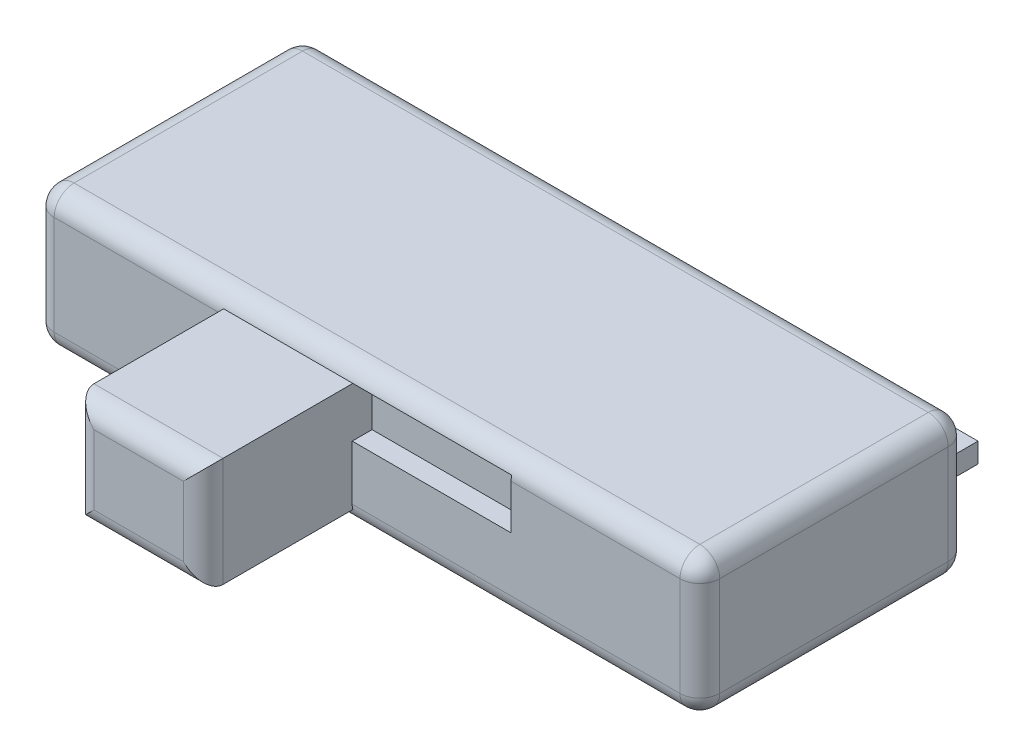
from build123d import *

# Parameters (mm, degrees)
SKETCH_1_W          = 6.7
SKETCH_1_H          = 2.7
EXTRUDE_1_DEPTH     = 1.4
SKETCH_2_W          = 2.9
SKETCH_2_H          = 0.5
CUT_EXTRUDE_1_DEPTH = 0.2
SKETCH_3_W          = 1.3
SKETCH_3_H          = 1.1
EXTRUDE_2_DEPTH     = 1.7
SKETCH_4_W          = 0.4
SKETCH_4_H          = 1
EXTRUDE_3_DEPTH     = 0.2
SKETCH_6_R          = 0.35
EXTRUDE_4_DEPTH     = 0.5
FILLET_1_R          = 0.2
CHAMFER_1_SIZE      = 0.2


with BuildPart() as part:
    # Эскиз1 → Бобышка-Вытянуть1 (new body)
    with BuildSketch(Plane(origin=(0, 0, 0), x_dir=(1, 0, 0), z_dir=(0, 1, 0))):
        Rectangle(SKETCH_1_W, SKETCH_1_H)
    extrude(amount=EXTRUDE_1_DEPTH)

    # Эскиз2 → Вырез-Вытянуть1 (cut)
    with BuildSketch(Plane.XY.offset(1.35)):
        with Locations((0, 1)):
            Rectangle(SKETCH_2_W, SKETCH_2_H)
    extrude(amount=-CUT_EXTRUDE_1_DEPTH, mode=Mode.SUBTRACT)

    # Эскиз3 → Бобышка-Вытянуть2 (add)
    with BuildSketch(Plane.XY.offset(1.15)):
        with Locations((-0.8, 0.7)):
            Rectangle(SKETCH_3_W, SKETCH_3_H)
    extrude(amount=EXTRUDE_2_DEPTH)

    # Эскиз4 → Бобышка-Вытянуть3 (add)
    with BuildSketch(Plane.XZ):
        with Locations((-2.25, -1.85)):
            Rectangle(SKETCH_4_W, SKETCH_4_H)
        with Locations((0.75, -1.85)):
            Rectangle(SKETCH_4_W, SKETCH_4_H)
        with Locations((2.25, -1.85)):
            Rectangle(SKETCH_4_W, SKETCH_4_H)
    extrude(amount=-EXTRUDE_3_DEPTH)

    # Эскиз6 → Бобышка-Вытянуть4 (add)
    with BuildSketch(Plane.XZ):
        with Locations(Location((-1.5, 0, 0), (0, 0, 270))):
            Circle(SKETCH_6_R)
        with Locations(Location((1.5, 0, 0), (0, 0, 270))):
            Circle(SKETCH_6_R)
    extrude(amount=EXTRUDE_4_DEPTH)

    # Скругление1
    # the kernel refuses this fillet: 0.2 mm, written as the material it takes off along each edge
    with BuildSketch(Plane(origin=(3.15, 0.2, 1.15), x_dir=(1, 0, 0), z_dir=(0, 0, 1))) as fillet_1_piece_1_section:
        Polygon((0, 0), (FILLET_1_R * 1.02, 0), (FILLET_1_R * 1.02, -FILLET_1_R * 1.02), (0, -FILLET_1_R * 1.02), align=None)
    fillet_1_piece_1 = extrude(amount=FILLET_1_R * 1.02, mode=Mode.PRIVATE)
    fillet_1_piece_1 = fillet_1_piece_1 - Plane(origin=(3.15, 0.2, 1.15), x_dir=(-0.7071067811865475, 0.7071067811865475, 0), z_dir=(0, 0, 1)) * Sphere(FILLET_1_R, mode=Mode.PRIVATE)
    add(fillet_1_piece_1, mode=Mode.SUBTRACT)
    with BuildSketch(Plane(origin=(3.15, 1.2, 1.15), x_dir=(0, 1, 0), z_dir=(0, 0, 1))) as fillet_1_piece_2_section:
        Polygon((0, 0), (FILLET_1_R * 1.02, 0), (FILLET_1_R * 1.02, -FILLET_1_R * 1.02), (0, -FILLET_1_R * 1.02), align=None)
    fillet_1_piece_2 = extrude(amount=FILLET_1_R * 1.02, mode=Mode.PRIVATE)
    fillet_1_piece_2 = fillet_1_piece_2 - Plane(origin=(3.15, 1.2, 1.15), x_dir=(-0.7071067811865475, -0.7071067811865475, 0), z_dir=(0, 0, 1)) * Sphere(FILLET_1_R, mode=Mode.PRIVATE)
    add(fillet_1_piece_2, mode=Mode.SUBTRACT)
    with BuildSketch(Plane(origin=(3.15, 1.2, -1.15), x_dir=(1, 0, 0), z_dir=(0, 1, 0))) as fillet_1_piece_3_section:
        Polygon((0, 0), (FILLET_1_R * 1.02, 0), (FILLET_1_R * 1.02, FILLET_1_R * 1.02), (0, FILLET_1_R * 1.02), align=None)
    fillet_1_piece_3 = extrude(amount=FILLET_1_R * 1.02, mode=Mode.PRIVATE)
    fillet_1_piece_3 = fillet_1_piece_3 - Plane(origin=(3.15, 1.2, -1.15), x_dir=(-0.7071067811865475, 0, 0.7071067811865475), z_dir=(0, 1, 0)) * Sphere(FILLET_1_R, mode=Mode.PRIVATE)
    add(fillet_1_piece_3, mode=Mode.SUBTRACT)
    with BuildSketch(Plane(origin=(3.15, 0.2, -1.15), x_dir=(0, 0, -1), z_dir=(1, 0, 0))) as fillet_1_piece_4_section:
        Polygon((0, 0), (FILLET_1_R * 1.02, 0), (FILLET_1_R * 1.02, -FILLET_1_R * 1.02), (0, -FILLET_1_R * 1.02), align=None)
    fillet_1_piece_4 = extrude(amount=FILLET_1_R * 1.02, mode=Mode.PRIVATE)
    fillet_1_piece_4 = fillet_1_piece_4 - Plane(origin=(3.15, 0.2, -1.15), x_dir=(0, 0.7071067811865475, 0.7071067811865475), z_dir=(1, 0, 0)) * Sphere(FILLET_1_R, mode=Mode.PRIVATE)
    add(fillet_1_piece_4, mode=Mode.SUBTRACT)
    with BuildSketch(Plane(origin=(-3.15, 0.2, -1.15), x_dir=(0, 0, -1), z_dir=(-1, 0, 0))) as fillet_1_piece_5_section:
        Polygon((0, 0), (FILLET_1_R * 1.02, 0), (FILLET_1_R * 1.02, FILLET_1_R * 1.02), (0, FILLET_1_R * 1.02), align=None)
    fillet_1_piece_5 = extrude(amount=FILLET_1_R * 1.02, mode=Mode.PRIVATE)
    fillet_1_piece_5 = fillet_1_piece_5 - Plane(origin=(-3.15, 0.2, -1.15), x_dir=(0, 0.7071067811865475, 0.7071067811865475), z_dir=(-1, 0, 0)) * Sphere(FILLET_1_R, mode=Mode.PRIVATE)
    add(fillet_1_piece_5, mode=Mode.SUBTRACT)
    with BuildSketch(Plane(origin=(-3.15, 1.2, -1.15), x_dir=(0, 1, 0), z_dir=(-1, 0, 0))) as fillet_1_piece_6_section:
        Polygon((0, 0), (FILLET_1_R * 1.02, 0), (FILLET_1_R * 1.02, FILLET_1_R * 1.02), (0, FILLET_1_R * 1.02), align=None)
    fillet_1_piece_6 = extrude(amount=FILLET_1_R * 1.02, mode=Mode.PRIVATE)
    fillet_1_piece_6 = fillet_1_piece_6 - Plane(origin=(-3.15, 1.2, -1.15), x_dir=(0, -0.7071067811865475, 0.7071067811865475), z_dir=(-1, 0, 0)) * Sphere(FILLET_1_R, mode=Mode.PRIVATE)
    add(fillet_1_piece_6, mode=Mode.SUBTRACT)
    with BuildSketch(Plane(origin=(-3.15, 1.2, 1.15), x_dir=(-1, 0, 0), z_dir=(0, 0, 1))) as fillet_1_piece_7_section:
        Polygon((0, 0), (FILLET_1_R * 1.02, 0), (FILLET_1_R * 1.02, -FILLET_1_R * 1.02), (0, -FILLET_1_R * 1.02), align=None)
    fillet_1_piece_7 = extrude(amount=FILLET_1_R * 1.02, mode=Mode.PRIVATE)
    fillet_1_piece_7 = fillet_1_piece_7 - Plane(origin=(-3.15, 1.2, 1.15), x_dir=(0.7071067811865475, -0.7071067811865475, 0), z_dir=(0, 0, 1)) * Sphere(FILLET_1_R, mode=Mode.PRIVATE)
    add(fillet_1_piece_7, mode=Mode.SUBTRACT)
    with BuildSketch(Plane(origin=(-3.15, 0.2, 1.15), x_dir=(-1, 0, 0), z_dir=(0, 0, 1))) as fillet_1_piece_8_section:
        Polygon((0, 0), (FILLET_1_R * 1.02, 0), (FILLET_1_R * 1.02, FILLET_1_R * 1.02), (0, FILLET_1_R * 1.02), align=None)
    fillet_1_piece_8 = extrude(amount=FILLET_1_R * 1.02, mode=Mode.PRIVATE)
    fillet_1_piece_8 = fillet_1_piece_8 - Plane(origin=(-3.15, 0.2, 1.15), x_dir=(0.7071067811865475, 0.7071067811865475, 0), z_dir=(0, 0, 1)) * Sphere(FILLET_1_R, mode=Mode.PRIVATE)
    add(fillet_1_piece_8, mode=Mode.SUBTRACT)
    with BuildSketch(Plane(origin=(3.35, 0.2, 1.35), x_dir=(-1, 0, 0), z_dir=(0, 1, 0)), Plane(origin=(3.35, 0.2, -1.35), x_dir=(0, 0, 1), z_dir=(0, 1, 0))) as fillet_1_piece_9:
        with BuildLine():
            CenterArc((FILLET_1_R, -FILLET_1_R), FILLET_1_R, 90, 90)
            Line((0, -FILLET_1_R), (0, 0))
            Line((0, 0), (FILLET_1_R, 0))
        make_face()
    extrude(amount=1, mode=Mode.SUBTRACT)
    with BuildSketch(Plane(origin=(3.35, 1.4, 1.15), x_dir=(-1, 0, 0), z_dir=(0, 0, -1)), Plane(origin=(3.35, 0, 1.15), x_dir=(0, 1, 0), z_dir=(0, 0, -1)), Plane(origin=(-3.35, 0, -1.15), x_dir=(0, 1, 0), z_dir=(0, 0, 1)), Plane(origin=(-1.95, 1.25, 2.85), x_dir=(0, 0, -1), z_dir=(1, 0, 0)), Plane(origin=(0.35, 0.15, 2.85), x_dir=(0, 0, -1), z_dir=(-1, 0, 0))) as fillet_1_piece_10:
        with BuildLine():
            CenterArc((FILLET_1_R, -FILLET_1_R), FILLET_1_R, 90, 90)
            Line((0, -FILLET_1_R), (0, 0))
            Line((0, 0), (FILLET_1_R, 0))
        make_face()
    extrude(amount=2.3, mode=Mode.SUBTRACT)
    with BuildSketch(Plane(origin=(-3.35, 0.2, -1.35), x_dir=(0, 0, 1), z_dir=(0, 1, 0)), Plane(origin=(-3.35, 0.2, 1.35), x_dir=(1, 0, 0), z_dir=(0, 1, 0))) as fillet_1_piece_11:
        with BuildLine():
            CenterArc((FILLET_1_R, FILLET_1_R), FILLET_1_R, 180, 90)
            Line((0, FILLET_1_R), (0, 0))
            Line((0, 0), (FILLET_1_R, 0))
        make_face()
    extrude(amount=1, mode=Mode.SUBTRACT)
    with BuildSketch(Plane(origin=(-3.35, 1.4, -1.15), x_dir=(0, -1, 0), z_dir=(0, 0, 1))) as fillet_1_piece_12:
        with BuildLine():
            CenterArc((FILLET_1_R, FILLET_1_R), FILLET_1_R, 180, 90)
            Line((0, FILLET_1_R), (0, 0))
            Line((0, 0), (FILLET_1_R, 0))
        make_face()
    extrude(amount=2.3, mode=Mode.SUBTRACT)
    with BuildSketch(Plane(origin=(3.15, 0, -1.35), x_dir=(0, 0, 1), z_dir=(-1, 0, 0)), Plane(origin=(-2.45, 0, -1.35), x_dir=(0, 0, 1), z_dir=(-1, 0, 0))) as fillet_1_piece_13:
        with BuildLine():
            CenterArc((FILLET_1_R, FILLET_1_R), FILLET_1_R, 180, 90)
            Line((0, FILLET_1_R), (0, 0))
            Line((0, 0), (FILLET_1_R, 0))
        make_face()
    extrude(amount=0.7, mode=Mode.SUBTRACT)
    with BuildSketch(Plane(origin=(3.15, 0, -1.35), x_dir=(0, 0, 1), z_dir=(-1, 0, 0))) as fillet_1_piece_14_section:
        with BuildLine():
            CenterArc((FILLET_1_R, FILLET_1_R), FILLET_1_R, 180, 90)
            Line((0, FILLET_1_R), (0, 0))
            Line((0, 0), (FILLET_1_R, 0))
        make_face()
    fillet_1_piece_14 = extrude(amount=1.2, mode=Mode.PRIVATE)
    fillet_1_piece_14 = split(fillet_1_piece_14, bisect_by=Plane(origin=(2.05, 0.044673588, -1.305326412), z_dir=(-1, 0, 0)), keep=Keep.TOP, mode=Mode.PRIVATE)
    add(fillet_1_piece_14, mode=Mode.SUBTRACT)
    with BuildSketch(Plane(origin=(2.55, 0, -1.35), x_dir=(0, 0, 1), z_dir=(-1, 0, 0))) as fillet_1_piece_15_section:
        with BuildLine():
            CenterArc((FILLET_1_R, FILLET_1_R), FILLET_1_R, 180, 90)
            Line((0, FILLET_1_R), (0, 0))
            Line((0, 0), (FILLET_1_R, 0))
        make_face()
    fillet_1_piece_15 = extrude(amount=2.1, mode=Mode.PRIVATE)
    fillet_1_piece_15 = split(fillet_1_piece_15, bisect_by=Plane(origin=(2.45, 0.044673588, -1.305326412), z_dir=(1, 0, 0)), keep=Keep.TOP, mode=Mode.PRIVATE)
    add(fillet_1_piece_15, mode=Mode.SUBTRACT)
    with BuildSketch(Plane(origin=(2.05, 0, -1.35), x_dir=(0, 0, 1), z_dir=(-1, 0, 0))) as fillet_1_piece_16:
        with BuildLine():
            CenterArc((FILLET_1_R, FILLET_1_R), FILLET_1_R, 180, 90)
            Line((0, FILLET_1_R), (0, 0))
            Line((0, 0), (FILLET_1_R, 0))
        make_face()
    extrude(amount=1.1, mode=Mode.SUBTRACT)
    with BuildSketch(Plane(origin=(2.55, 0, -1.35), x_dir=(0, 0, 1), z_dir=(-1, 0, 0))) as fillet_1_piece_17_section:
        with BuildLine():
            CenterArc((FILLET_1_R, FILLET_1_R), FILLET_1_R, 180, 90)
            Line((0, FILLET_1_R), (0, 0))
            Line((0, 0), (FILLET_1_R, 0))
        make_face()
    fillet_1_piece_17 = extrude(amount=2.1, mode=Mode.PRIVATE)
    fillet_1_piece_17 = split(fillet_1_piece_17, bisect_by=Plane(origin=(0.55, 0.044673588, -1.305326412), z_dir=(-1, 0, 0)), keep=Keep.TOP, mode=Mode.PRIVATE)
    add(fillet_1_piece_17, mode=Mode.SUBTRACT)
    with BuildSketch(Plane(origin=(1.05, 0, -1.35), x_dir=(0, 0, 1), z_dir=(-1, 0, 0))) as fillet_1_piece_18_section:
        with BuildLine():
            CenterArc((FILLET_1_R, FILLET_1_R), FILLET_1_R, 180, 90)
            Line((0, FILLET_1_R), (0, 0))
            Line((0, 0), (FILLET_1_R, 0))
        make_face()
    fillet_1_piece_18 = extrude(amount=3.6, mode=Mode.PRIVATE)
    fillet_1_piece_18 = split(fillet_1_piece_18, bisect_by=Plane(origin=(0.95, 0.044673588, -1.305326412), z_dir=(1, 0, 0)), keep=Keep.TOP, mode=Mode.PRIVATE)
    add(fillet_1_piece_18, mode=Mode.SUBTRACT)
    with BuildSketch(Plane(origin=(0.55, 0, -1.35), x_dir=(0, 0, 1), z_dir=(-1, 0, 0))) as fillet_1_piece_19:
        with BuildLine():
            CenterArc((FILLET_1_R, FILLET_1_R), FILLET_1_R, 180, 90)
            Line((0, FILLET_1_R), (0, 0))
            Line((0, 0), (FILLET_1_R, 0))
        make_face()
    extrude(amount=2.6, mode=Mode.SUBTRACT)
    with BuildSketch(Plane(origin=(1.05, 0, -1.35), x_dir=(0, 0, 1), z_dir=(-1, 0, 0))) as fillet_1_piece_20_section:
        with BuildLine():
            CenterArc((FILLET_1_R, FILLET_1_R), FILLET_1_R, 180, 90)
            Line((0, FILLET_1_R), (0, 0))
            Line((0, 0), (FILLET_1_R, 0))
        make_face()
    fillet_1_piece_20 = extrude(amount=3.6, mode=Mode.PRIVATE)
    fillet_1_piece_20 = split(fillet_1_piece_20, bisect_by=Plane(origin=(-2.45, 0.044673588, -1.305326412), z_dir=(-1, 0, 0)), keep=Keep.TOP, mode=Mode.PRIVATE)
    add(fillet_1_piece_20, mode=Mode.SUBTRACT)
    with BuildSketch(Plane(origin=(-1.95, 0, -1.35), x_dir=(0, 0, 1), z_dir=(-1, 0, 0))) as fillet_1_piece_21_section:
        with BuildLine():
            CenterArc((FILLET_1_R, FILLET_1_R), FILLET_1_R, 180, 90)
            Line((0, FILLET_1_R), (0, 0))
            Line((0, 0), (FILLET_1_R, 0))
        make_face()
    fillet_1_piece_21 = extrude(amount=1.2, mode=Mode.PRIVATE)
    fillet_1_piece_21 = split(fillet_1_piece_21, bisect_by=Plane(origin=(-2.05, 0.044673588, -1.305326412), z_dir=(1, 0, 0)), keep=Keep.TOP, mode=Mode.PRIVATE)
    add(fillet_1_piece_21, mode=Mode.SUBTRACT)
    with BuildSketch(Plane(origin=(3.15, 1.4, -1.35), x_dir=(0, 0, 1), z_dir=(-1, 0, 0))) as fillet_1_piece_22:
        with BuildLine():
            CenterArc((FILLET_1_R, -FILLET_1_R), FILLET_1_R, 90, 90)
            Line((0, -FILLET_1_R), (0, 0))
            Line((0, 0), (FILLET_1_R, 0))
        make_face()
    extrude(amount=6.3, mode=Mode.SUBTRACT)
    with BuildSketch(Plane(origin=(-3.15, 1.4, 1.35), x_dir=(0, -1, 0), z_dir=(1, 0, 0))) as fillet_1_piece_23_section:
        with BuildLine():
            CenterArc((FILLET_1_R, FILLET_1_R), FILLET_1_R, 180, 90)
            Line((0, FILLET_1_R), (0, 0))
            Line((0, 0), (FILLET_1_R, 0))
        make_face()
    fillet_1_piece_23 = extrude(amount=6.3, mode=Mode.PRIVATE)
    fillet_1_piece_23 = split(fillet_1_piece_23, bisect_by=Plane(origin=(-1.45, 1.237540036, 1.34810005), z_dir=(-1, 0, 0)), keep=Keep.TOP, mode=Mode.PRIVATE)
    add(fillet_1_piece_23, mode=Mode.SUBTRACT)
    with BuildSketch(Plane(origin=(-3.15, 1.4, 1.35), x_dir=(0, -1, 0), z_dir=(1, 0, 0))) as fillet_1_piece_24_section:
        with BuildLine():
            CenterArc((FILLET_1_R, FILLET_1_R), FILLET_1_R, 180, 90)
            Line((0, FILLET_1_R), (0, 0))
            Line((0, 0), (FILLET_1_R, 0))
        make_face()
    fillet_1_piece_24 = extrude(amount=6.3, mode=Mode.PRIVATE)
    fillet_1_piece_24 = split(fillet_1_piece_24, bisect_by=Plane(origin=(-0.8, 1.25, 1.304795882), z_dir=(0, 1, 0)), keep=Keep.TOP, mode=Mode.PRIVATE)
    add(fillet_1_piece_24, mode=Mode.SUBTRACT)
    with BuildSketch(Plane(origin=(-3.15, 1.4, 1.35), x_dir=(0, -1, 0), z_dir=(1, 0, 0))) as fillet_1_piece_25_section:
        with BuildLine():
            CenterArc((FILLET_1_R, FILLET_1_R), FILLET_1_R, 180, 90)
            Line((0, FILLET_1_R), (0, 0))
            Line((0, 0), (FILLET_1_R, 0))
        make_face()
    fillet_1_piece_25 = extrude(amount=6.3, mode=Mode.PRIVATE)
    fillet_1_piece_25 = split(fillet_1_piece_25, bisect_by=Plane(origin=(-0.15, 1.237540036, 1.34810005), z_dir=(1, 0, 0)), keep=Keep.TOP, mode=Mode.PRIVATE)
    add(fillet_1_piece_25, mode=Mode.SUBTRACT)
    with BuildSketch(Plane(origin=(-3.15, 0, 1.35), x_dir=(0, 1, 0), z_dir=(1, 0, 0))) as fillet_1_piece_26_section:
        with BuildLine():
            CenterArc((FILLET_1_R, -FILLET_1_R), FILLET_1_R, 90, 90)
            Line((0, -FILLET_1_R), (0, 0))
            Line((0, 0), (FILLET_1_R, 0))
        make_face()
    fillet_1_piece_26 = extrude(amount=6.3, mode=Mode.PRIVATE)
    fillet_1_piece_26 = split(fillet_1_piece_26, bisect_by=Plane(origin=(-1.45, 0.162459964, 1.34810005), z_dir=(-1, 0, 0)), keep=Keep.TOP, mode=Mode.PRIVATE)
    add(fillet_1_piece_26, mode=Mode.SUBTRACT)
    with BuildSketch(Plane(origin=(-3.15, 0, 1.35), x_dir=(0, 1, 0), z_dir=(1, 0, 0))) as fillet_1_piece_27_section:
        with BuildLine():
            CenterArc((FILLET_1_R, -FILLET_1_R), FILLET_1_R, 90, 90)
            Line((0, -FILLET_1_R), (0, 0))
            Line((0, 0), (FILLET_1_R, 0))
        make_face()
    fillet_1_piece_27 = extrude(amount=6.3, mode=Mode.PRIVATE)
    fillet_1_piece_27 = split(fillet_1_piece_27, bisect_by=Plane(origin=(-0.8, 0.15, 1.304795882), z_dir=(0, -1, 0)), keep=Keep.TOP, mode=Mode.PRIVATE)
    add(fillet_1_piece_27, mode=Mode.SUBTRACT)
    with BuildSketch(Plane(origin=(-3.15, 0, 1.35), x_dir=(0, 1, 0), z_dir=(1, 0, 0))) as fillet_1_piece_28_section:
        with BuildLine():
            CenterArc((FILLET_1_R, -FILLET_1_R), FILLET_1_R, 90, 90)
            Line((0, -FILLET_1_R), (0, 0))
            Line((0, 0), (FILLET_1_R, 0))
        make_face()
    fillet_1_piece_28 = extrude(amount=6.3, mode=Mode.PRIVATE)
    fillet_1_piece_28 = split(fillet_1_piece_28, bisect_by=Plane(origin=(-0.15, 0.162459964, 1.34810005), z_dir=(1, 0, 0)), keep=Keep.TOP, mode=Mode.PRIVATE)
    add(fillet_1_piece_28, mode=Mode.SUBTRACT)
    with BuildSketch(Plane(origin=(-0.15, 1.75, 2.85), x_dir=(0, 0, -1), z_dir=(0, -1, 0)), Plane(origin=(-1.45, -0.35, 2.85), x_dir=(0, 0, -1), z_dir=(0, 1, 0))) as fillet_1_piece_29:
        with BuildLine():
            CenterArc((FILLET_1_R, -FILLET_1_R), FILLET_1_R, 90, 90)
            Line((0, -FILLET_1_R), (0, 0))
            Line((0, 0), (FILLET_1_R, 0))
        make_face()
    extrude(amount=2.1, mode=Mode.SUBTRACT)

    # Фаска1
    chamfer_1_edges = [part.edges().sort_by_distance(p)[0] for p in [
        (-1.5, -0.5, 0.35),
        (1.5, -0.5, 0.35),
    ]]
    chamfer(chamfer_1_edges, length=CHAMFER_1_SIZE)


solid = part.part
